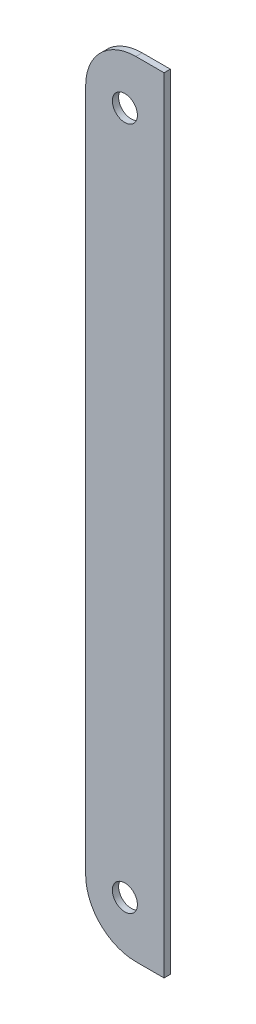
from build123d import *

# Parameters (mm, degrees)
SKETCH1_R           = 4
BOSS_EXTRUDE1_DEPTH = 2


with BuildPart() as part:
    # Sketch1 → Boss-Extrude1 (new body)
    with BuildSketch(Plane.XY):
        with BuildLine():
            Line((3.5, 125), (12.5, 125))
            Line((12.5, 125), (12.5, -125))
            Line((12.5, -125), (3.5, -125))
            ThreePointArc((3.5, -125), (-7.813708499, -120.313708499), (-12.5, -109))
            Line((-12.5, -109), (-12.5, 109))
            ThreePointArc((-12.5, 109), (-7.813708499, 120.313708499), (3.5, 125))
        make_face()
        with Locations((0, 109)):
            Circle(SKETCH1_R, mode=Mode.SUBTRACT)
        with Locations((0, -109)):
            Circle(SKETCH1_R, mode=Mode.SUBTRACT)
    extrude(amount=BOSS_EXTRUDE1_DEPTH)


solid = part.part
